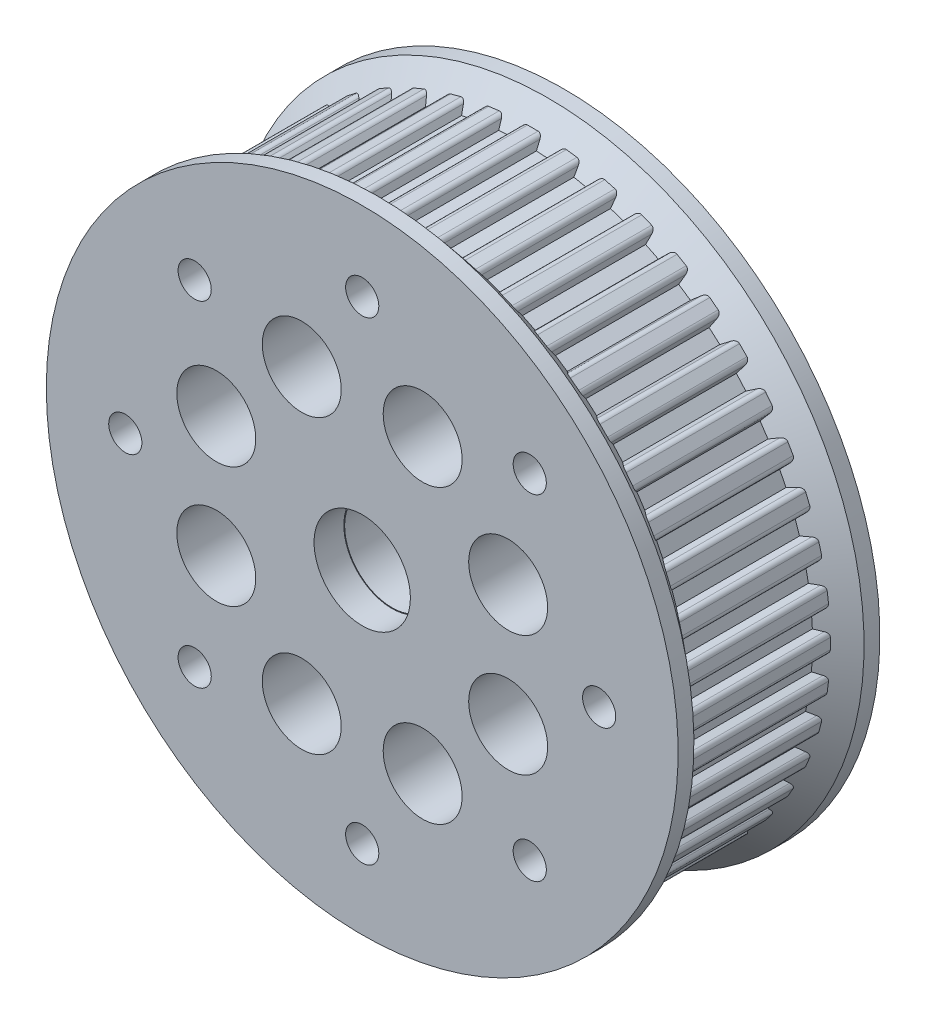
from build123d import *

# Parameters (mm, degrees)
ESQUISSE1_R                  = 6
BOSS_EXTRU_1_DEPTH           = 18
ESQUISSE3_R                  = 2.1
ENL_V_MAT_EXTRU_1_DEPTH      = 63.918405739
ENL_V_MAT_EXTRU_2_DEPTH      = 12
ENL_V_MAT_EXTRU_2_DEPTH_BACK = 12
ESQUISSE4_W                  = 30
ESQUISSE4_H                  = 3
ESQUISSE5_R                  = 8.6
ESQUISSE5_R_2                = 6.1
ENL_V_MAT_EXTRU_3_DEPTH      = 2
ESQUISSE6_R                  = 5
ENL_V_MAT_EXTRU_4_DEPTH      = 63.068880063


with BuildPart() as part:
    # Esquisse1 → Boss.-Extru.1 (new body)
    with BuildSketch(Plane.XY):
        with BuildLine():
            Line((1.485544014, 36.425831274), (3.281690076, 36.308105641))
            Line((3.281690076, 36.308105641), (3.625856871, 37.090284182))
            ThreePointArc((3.625856871, 37.090284182), (3.880729617, 37.371492923), (4.253359473, 37.443503085))
            Line((4.253359473, 37.443503085), (4.918010712, 37.356000089))
            Line((4.918010712, 37.356000089), (5.58266195, 37.268497094))
            ThreePointArc((5.58266195, 37.268497094), (5.92395715, 37.102496915), (6.097363141, 36.764904209))
            Line((6.097363141, 36.764904209), (6.227360034, 35.920300834))
            Line((6.227360034, 35.920300834), (7.992773538, 35.569138254))
            Line((7.992773538, 35.569138254), (8.436090725, 36.299702368))
            ThreePointArc((8.436090725, 36.299702368), (8.725488106, 36.545237761), (9.104329275, 36.567993909))
            Line((9.104329275, 36.567993909), (9.751872896, 36.394485118))
            Line((9.751872896, 36.394485118), (10.399416518, 36.220976328))
            ThreePointArc((10.399416518, 36.220976328), (10.71612452, 36.011848341), (10.843982307, 35.654509763))
            Line((10.843982307, 35.654509763), (10.862624196, 34.800164088))
            Line((10.862624196, 34.800164088), (12.56709843, 34.221573051))
            Line((12.56709843, 34.221573051), (13.101980728, 34.888022583))
            ThreePointArc((13.101980728, 34.888022583), (13.420951075, 35.093683448), (13.799521478, 35.066796219))
            Line((13.799521478, 35.066796219), (14.418877832, 34.810250417))
            Line((14.418877832, 34.810250417), (15.038234187, 34.553704615))
            ThreePointArc((15.038234187, 34.553704615), (15.324936028, 34.305027057), (15.40505793, 33.93405677))
            Line((15.40505793, 33.93405677), (15.312025848, 33.084586886))
            Line((15.312025848, 33.084586886), (16.926396782, 32.288467244))
            Line((16.926396782, 32.288467244), (17.543692209, 32.879399058))
            ThreePointArc((17.543692209, 32.879399058), (17.886777849, 33.041666481), (18.258600042, 32.965595923))
            Line((18.258600042, 32.965595923), (18.839171771, 32.630402679))
            Line((18.839171771, 32.630402679), (19.419743499, 32.295209436))
            ThreePointArc((19.419743499, 32.295209436), (19.671533631, 32.01123725), (19.702548741, 31.632982658))
            Line((19.702548741, 31.632982658), (19.499434491, 30.80292323))
            Line((19.499434491, 30.80292323), (20.996079793, 29.802896811))
            Line((20.996079793, 29.802896811), (21.685226251, 30.3081999))
            ThreePointArc((21.685226251, 30.3081999), (22.046556895, 30.42429744), (22.405268898, 30.300345141))
            Line((22.405268898, 30.300345141), (22.937122257, 29.892239705))
            Line((22.937122257, 29.892239705), (23.468975616, 29.484134269))
            ThreePointArc((23.468975616, 29.484134269), (23.681545841, 29.169726297), (23.66292348, 28.790659442))
            Line((23.66292348, 28.790659442), (23.353202405, 27.994213017))
            Line((23.353202405, 27.994213017), (24.706514058, 26.80739055))
            Line((24.706514058, 26.80739055), (25.455720061, 27.218419038))
            ThreePointArc((25.455720061, 27.218419038), (25.829113241, 27.286360235), (26.168577391, 27.116647053))
            Line((26.168577391, 27.116647053), (26.642612222, 26.642612222))
            Line((26.642612222, 26.642612222), (27.116647053, 26.168577391))
            ThreePointArc((27.116647053, 26.168577391), (27.286360235, 25.829113241), (27.218419038, 25.455720061))
            Line((27.218419038, 25.455720061), (26.80739055, 24.706514058))
            Line((26.80739055, 24.706514058), (27.994213017, 23.353202405))
            Line((27.994213017, 23.353202405), (28.790659442, 23.66292348))
            ThreePointArc((28.790659442, 23.66292348), (29.169726297, 23.681545841), (29.484134269, 23.468975616))
            Line((29.484134269, 23.468975616), (29.892239705, 22.937122257))
            Line((29.892239705, 22.937122257), (30.300345141, 22.405268898))
            ThreePointArc((30.300345141, 22.405268898), (30.42429744, 22.046556895), (30.3081999, 21.685226251))
            Line((30.3081999, 21.685226251), (29.802896811, 20.996079793))
            Line((29.802896811, 20.996079793), (30.80292323, 19.499434491))
            Line((30.80292323, 19.499434491), (31.632982658, 19.702548741))
            ThreePointArc((31.632982658, 19.702548741), (32.01123725, 19.671533631), (32.295209436, 19.419743499))
            Line((32.295209436, 19.419743499), (32.630402679, 18.839171771))
            Line((32.630402679, 18.839171771), (32.965595923, 18.258600042))
            ThreePointArc((32.965595923, 18.258600042), (33.041666481, 17.886777849), (32.879399058, 17.543692209))
            Line((32.879399058, 17.543692209), (32.288467244, 16.926396782))
            Line((32.288467244, 16.926396782), (33.084586886, 15.312025848))
            Line((33.084586886, 15.312025848), (33.93405677, 15.40505793))
            ThreePointArc((33.93405677, 15.40505793), (34.305027057, 15.324936028), (34.553704615, 15.038234187))
            Line((34.553704615, 15.038234187), (34.810250417, 14.418877832))
            Line((34.810250417, 14.418877832), (35.066796219, 13.799521478))
            ThreePointArc((35.066796219, 13.799521478), (35.093683448, 13.420951075), (34.888022583, 13.101980728))
            Line((34.888022583, 13.101980728), (34.221573051, 12.56709843))
            Line((34.221573051, 12.56709843), (34.800164088, 10.862624196))
            Line((34.800164088, 10.862624196), (35.654509763, 10.843982307))
            ThreePointArc((35.654509763, 10.843982307), (36.011848341, 10.71612452), (36.220976328, 10.399416518))
            Line((36.220976328, 10.399416518), (36.394485118, 9.751872896))
            Line((36.394485118, 9.751872896), (36.567993909, 9.104329275))
            ThreePointArc((36.567993909, 9.104329275), (36.545237761, 8.725488106), (36.299702368, 8.436090725))
            Line((36.299702368, 8.436090725), (35.569138254, 7.992773538))
            Line((35.569138254, 7.992773538), (35.920300834, 6.227360034))
            Line((35.920300834, 6.227360034), (36.764904209, 6.097363141))
            ThreePointArc((36.764904209, 6.097363141), (37.102496915, 5.92395715), (37.268497094, 5.58266195))
            Line((37.268497094, 5.58266195), (37.356000089, 4.918010712))
            Line((37.356000089, 4.918010712), (37.443503085, 4.253359473))
            ThreePointArc((37.443503085, 4.253359473), (37.371492923, 3.880729617), (37.090284182, 3.625856871))
            Line((37.090284182, 3.625856871), (36.308105641, 3.281690076))
            Line((36.308105641, 3.281690076), (36.425831274, 1.485544014))
            Line((36.425831274, 1.485544014), (37.24624095, 1.2464164))
            ThreePointArc((37.24624095, 1.2464164), (37.55831148, 1.030429231), (37.678343541, 0.670386487))
            Line((37.678343541, 0.670386487), (37.678343541, 0))
            Line((37.678343541, 0), (37.678343541, -0.670386487))
            ThreePointArc((37.678343541, -0.670386487), (37.55831148, -1.030429231), (37.24624095, -1.2464164))
            Line((37.24624095, -1.2464164), (36.425831274, -1.485544014))
            Line((36.425831274, -1.485544014), (36.308105641, -3.281690076))
            Line((36.308105641, -3.281690076), (37.090284182, -3.625856871))
            ThreePointArc((37.090284182, -3.625856871), (37.371492923, -3.880729617), (37.443503085, -4.253359473))
            Line((37.443503085, -4.253359473), (37.356000089, -4.918010712))
            Line((37.356000089, -4.918010712), (37.268497094, -5.58266195))
            ThreePointArc((37.268497094, -5.58266195), (37.102496915, -5.92395715), (36.764904209, -6.097363141))
            Line((36.764904209, -6.097363141), (35.920300834, -6.227360034))
            Line((35.920300834, -6.227360034), (35.569138254, -7.992773538))
            Line((35.569138254, -7.992773538), (36.299702368, -8.436090725))
            ThreePointArc((36.299702368, -8.436090725), (36.545237761, -8.725488106), (36.567993909, -9.104329275))
            Line((36.567993909, -9.104329275), (36.394485118, -9.751872896))
            Line((36.394485118, -9.751872896), (36.220976328, -10.399416518))
            ThreePointArc((36.220976328, -10.399416518), (36.011848341, -10.71612452), (35.654509763, -10.843982307))
            Line((35.654509763, -10.843982307), (34.800164088, -10.862624196))
            Line((34.800164088, -10.862624196), (34.221573051, -12.56709843))
            Line((34.221573051, -12.56709843), (34.888022583, -13.101980728))
            ThreePointArc((34.888022583, -13.101980728), (35.093683448, -13.420951075), (35.066796219, -13.799521478))
            Line((35.066796219, -13.799521478), (34.810250417, -14.418877832))
            Line((34.810250417, -14.418877832), (34.553704615, -15.038234187))
            ThreePointArc((34.553704615, -15.038234187), (34.305027057, -15.324936028), (33.93405677, -15.40505793))
            Line((33.93405677, -15.40505793), (33.084586886, -15.312025848))
            Line((33.084586886, -15.312025848), (32.288467244, -16.926396782))
            Line((32.288467244, -16.926396782), (32.879399058, -17.543692209))
            ThreePointArc((32.879399058, -17.543692209), (33.041666481, -17.886777849), (32.965595923, -18.258600042))
            Line((32.965595923, -18.258600042), (32.630402679, -18.839171771))
            Line((32.630402679, -18.839171771), (32.295209436, -19.419743499))
            ThreePointArc((32.295209436, -19.419743499), (32.01123725, -19.671533631), (31.632982658, -19.702548741))
            Line((31.632982658, -19.702548741), (30.80292323, -19.499434491))
            Line((30.80292323, -19.499434491), (29.802896811, -20.996079793))
            Line((29.802896811, -20.996079793), (30.3081999, -21.685226251))
            ThreePointArc((30.3081999, -21.685226251), (30.42429744, -22.046556895), (30.300345141, -22.405268898))
            Line((30.300345141, -22.405268898), (29.892239705, -22.937122257))
            Line((29.892239705, -22.937122257), (29.484134269, -23.468975616))
            ThreePointArc((29.484134269, -23.468975616), (29.169726297, -23.681545841), (28.790659442, -23.66292348))
            Line((28.790659442, -23.66292348), (27.994213017, -23.353202405))
            Line((27.994213017, -23.353202405), (26.80739055, -24.706514058))
            Line((26.80739055, -24.706514058), (27.218419038, -25.455720061))
            ThreePointArc((27.218419038, -25.455720061), (27.286360235, -25.829113241), (27.116647053, -26.168577391))
            Line((27.116647053, -26.168577391), (26.642612222, -26.642612222))
            Line((26.642612222, -26.642612222), (26.168577391, -27.116647053))
            ThreePointArc((26.168577391, -27.116647053), (25.829113241, -27.286360235), (25.455720061, -27.218419038))
            Line((25.455720061, -27.218419038), (24.706514058, -26.80739055))
            Line((24.706514058, -26.80739055), (23.353202405, -27.994213017))
            Line((23.353202405, -27.994213017), (23.66292348, -28.790659442))
            ThreePointArc((23.66292348, -28.790659442), (23.681545841, -29.169726297), (23.468975616, -29.484134269))
            Line((23.468975616, -29.484134269), (22.937122257, -29.892239705))
            Line((22.937122257, -29.892239705), (22.405268898, -30.300345141))
            ThreePointArc((22.405268898, -30.300345141), (22.046556895, -30.42429744), (21.685226251, -30.3081999))
            Line((21.685226251, -30.3081999), (20.996079793, -29.802896811))
            Line((20.996079793, -29.802896811), (19.499434491, -30.80292323))
            Line((19.499434491, -30.80292323), (19.702548741, -31.632982658))
            ThreePointArc((19.702548741, -31.632982658), (19.671533631, -32.01123725), (19.419743499, -32.295209436))
            Line((19.419743499, -32.295209436), (18.839171771, -32.630402679))
            Line((18.839171771, -32.630402679), (18.258600042, -32.965595923))
            ThreePointArc((18.258600042, -32.965595923), (17.886777849, -33.041666481), (17.543692209, -32.879399058))
            Line((17.543692209, -32.879399058), (16.926396782, -32.288467244))
            Line((16.926396782, -32.288467244), (15.312025848, -33.084586886))
            Line((15.312025848, -33.084586886), (15.40505793, -33.93405677))
            ThreePointArc((15.40505793, -33.93405677), (15.324936028, -34.305027057), (15.038234187, -34.553704615))
            Line((15.038234187, -34.553704615), (14.418877832, -34.810250417))
            Line((14.418877832, -34.810250417), (13.799521478, -35.066796219))
            ThreePointArc((13.799521478, -35.066796219), (13.420951075, -35.093683448), (13.101980728, -34.888022583))
            Line((13.101980728, -34.888022583), (12.56709843, -34.221573051))
            Line((12.56709843, -34.221573051), (10.862624196, -34.800164088))
            Line((10.862624196, -34.800164088), (10.843982307, -35.654509763))
            ThreePointArc((10.843982307, -35.654509763), (10.71612452, -36.011848341), (10.399416518, -36.220976328))
            Line((10.399416518, -36.220976328), (9.751872896, -36.394485118))
            Line((9.751872896, -36.394485118), (9.104329275, -36.567993909))
            ThreePointArc((9.104329275, -36.567993909), (8.725488106, -36.545237761), (8.436090725, -36.299702368))
            Line((8.436090725, -36.299702368), (7.992773538, -35.569138254))
            Line((7.992773538, -35.569138254), (6.227360034, -35.920300834))
            Line((6.227360034, -35.920300834), (6.097363141, -36.764904209))
            ThreePointArc((6.097363141, -36.764904209), (5.92395715, -37.102496915), (5.58266195, -37.268497094))
            Line((5.58266195, -37.268497094), (4.918010712, -37.356000089))
            Line((4.918010712, -37.356000089), (4.253359473, -37.443503085))
            ThreePointArc((4.253359473, -37.443503085), (3.880729617, -37.371492923), (3.625856871, -37.090284182))
            Line((3.625856871, -37.090284182), (3.281690076, -36.308105641))
            Line((3.281690076, -36.308105641), (1.485544014, -36.425831274))
            Line((1.485544014, -36.425831274), (1.2464164, -37.24624095))
            ThreePointArc((1.2464164, -37.24624095), (1.030429231, -37.55831148), (0.670386487, -37.678343541))
            Line((0.670386487, -37.678343541), (0, -37.678343541))
            Line((0, -37.678343541), (-0.670386487, -37.678343541))
            ThreePointArc((-0.670386487, -37.678343541), (-1.030429231, -37.55831148), (-1.2464164, -37.24624095))
            Line((-1.2464164, -37.24624095), (-1.485544014, -36.425831274))
            Line((-1.485544014, -36.425831274), (-3.281690076, -36.308105641))
            Line((-3.281690076, -36.308105641), (-3.625856871, -37.090284182))
            ThreePointArc((-3.625856871, -37.090284182), (-3.880729617, -37.371492923), (-4.253359473, -37.443503085))
            Line((-4.253359473, -37.443503085), (-4.918010712, -37.356000089))
            Line((-4.918010712, -37.356000089), (-5.58266195, -37.268497094))
            ThreePointArc((-5.58266195, -37.268497094), (-5.92395715, -37.102496915), (-6.097363141, -36.764904209))
            Line((-6.097363141, -36.764904209), (-6.227360034, -35.920300834))
            Line((-6.227360034, -35.920300834), (-7.992773538, -35.569138254))
            Line((-7.992773538, -35.569138254), (-8.436090725, -36.299702368))
            ThreePointArc((-8.436090725, -36.299702368), (-8.725488106, -36.545237761), (-9.104329275, -36.567993909))
            Line((-9.104329275, -36.567993909), (-9.751872896, -36.394485118))
            Line((-9.751872896, -36.394485118), (-10.399416518, -36.220976328))
            ThreePointArc((-10.399416518, -36.220976328), (-10.71612452, -36.011848341), (-10.843982307, -35.654509763))
            Line((-10.843982307, -35.654509763), (-10.862624196, -34.800164088))
            Line((-10.862624196, -34.800164088), (-12.56709843, -34.221573051))
            Line((-12.56709843, -34.221573051), (-13.101980728, -34.888022583))
            ThreePointArc((-13.101980728, -34.888022583), (-13.420951075, -35.093683448), (-13.799521478, -35.066796219))
            Line((-13.799521478, -35.066796219), (-14.418877832, -34.810250417))
            Line((-14.418877832, -34.810250417), (-15.038234187, -34.553704615))
            ThreePointArc((-15.038234187, -34.553704615), (-15.324936028, -34.305027057), (-15.40505793, -33.93405677))
            Line((-15.40505793, -33.93405677), (-15.312025848, -33.084586886))
            Line((-15.312025848, -33.084586886), (-16.926396782, -32.288467244))
            Line((-16.926396782, -32.288467244), (-17.543692209, -32.879399058))
            ThreePointArc((-17.543692209, -32.879399058), (-17.886777849, -33.041666481), (-18.258600042, -32.965595923))
            Line((-18.258600042, -32.965595923), (-18.839171771, -32.630402679))
            Line((-18.839171771, -32.630402679), (-19.419743499, -32.295209436))
            ThreePointArc((-19.419743499, -32.295209436), (-19.671533631, -32.01123725), (-19.702548741, -31.632982658))
            Line((-19.702548741, -31.632982658), (-19.499434491, -30.80292323))
            Line((-19.499434491, -30.80292323), (-20.996079793, -29.802896811))
            Line((-20.996079793, -29.802896811), (-21.685226251, -30.3081999))
            ThreePointArc((-21.685226251, -30.3081999), (-22.046556895, -30.42429744), (-22.405268898, -30.300345141))
            Line((-22.405268898, -30.300345141), (-22.937122257, -29.892239705))
            Line((-22.937122257, -29.892239705), (-23.468975616, -29.484134269))
            ThreePointArc((-23.468975616, -29.484134269), (-23.681545841, -29.169726297), (-23.66292348, -28.790659442))
            Line((-23.66292348, -28.790659442), (-23.353202405, -27.994213017))
            Line((-23.353202405, -27.994213017), (-24.706514058, -26.80739055))
            Line((-24.706514058, -26.80739055), (-25.455720061, -27.218419038))
            ThreePointArc((-25.455720061, -27.218419038), (-25.829113241, -27.286360235), (-26.168577391, -27.116647053))
            Line((-26.168577391, -27.116647053), (-26.642612222, -26.642612222))
            Line((-26.642612222, -26.642612222), (-27.116647053, -26.168577391))
            ThreePointArc((-27.116647053, -26.168577391), (-27.286360235, -25.829113241), (-27.218419038, -25.455720061))
            Line((-27.218419038, -25.455720061), (-26.80739055, -24.706514058))
            Line((-26.80739055, -24.706514058), (-27.994213017, -23.353202405))
            Line((-27.994213017, -23.353202405), (-28.790659442, -23.66292348))
            ThreePointArc((-28.790659442, -23.66292348), (-29.169726297, -23.681545841), (-29.484134269, -23.468975616))
            Line((-29.484134269, -23.468975616), (-29.892239705, -22.937122257))
            Line((-29.892239705, -22.937122257), (-30.300345141, -22.405268898))
            ThreePointArc((-30.300345141, -22.405268898), (-30.42429744, -22.046556895), (-30.3081999, -21.685226251))
            Line((-30.3081999, -21.685226251), (-29.802896811, -20.996079793))
            Line((-29.802896811, -20.996079793), (-30.80292323, -19.499434491))
            Line((-30.80292323, -19.499434491), (-31.632982658, -19.702548741))
            ThreePointArc((-31.632982658, -19.702548741), (-32.01123725, -19.671533631), (-32.295209436, -19.419743499))
            Line((-32.295209436, -19.419743499), (-32.630402679, -18.839171771))
            Line((-32.630402679, -18.839171771), (-32.965595923, -18.258600042))
            ThreePointArc((-32.965595923, -18.258600042), (-33.041666481, -17.886777849), (-32.879399058, -17.543692209))
            Line((-32.879399058, -17.543692209), (-32.288467244, -16.926396782))
            Line((-32.288467244, -16.926396782), (-33.084586886, -15.312025848))
            Line((-33.084586886, -15.312025848), (-33.93405677, -15.40505793))
            ThreePointArc((-33.93405677, -15.40505793), (-34.305027057, -15.324936028), (-34.553704615, -15.038234187))
            Line((-34.553704615, -15.038234187), (-34.810250417, -14.418877832))
            Line((-34.810250417, -14.418877832), (-35.066796219, -13.799521478))
            ThreePointArc((-35.066796219, -13.799521478), (-35.093683448, -13.420951075), (-34.888022583, -13.101980728))
            Line((-34.888022583, -13.101980728), (-34.221573051, -12.56709843))
            Line((-34.221573051, -12.56709843), (-34.800164088, -10.862624196))
            Line((-34.800164088, -10.862624196), (-35.654509763, -10.843982307))
            ThreePointArc((-35.654509763, -10.843982307), (-36.011848341, -10.71612452), (-36.220976328, -10.399416518))
            Line((-36.220976328, -10.399416518), (-36.394485118, -9.751872896))
            Line((-36.394485118, -9.751872896), (-36.567993909, -9.104329275))
            ThreePointArc((-36.567993909, -9.104329275), (-36.545237761, -8.725488106), (-36.299702368, -8.436090725))
            Line((-36.299702368, -8.436090725), (-35.569138254, -7.992773538))
            Line((-35.569138254, -7.992773538), (-35.920300834, -6.227360034))
            Line((-35.920300834, -6.227360034), (-36.764904209, -6.097363141))
            ThreePointArc((-36.764904209, -6.097363141), (-37.102496915, -5.92395715), (-37.268497094, -5.58266195))
            Line((-37.268497094, -5.58266195), (-37.356000089, -4.918010712))
            Line((-37.356000089, -4.918010712), (-37.443503085, -4.253359473))
            ThreePointArc((-37.443503085, -4.253359473), (-37.371492923, -3.880729617), (-37.090284182, -3.625856871))
            Line((-37.090284182, -3.625856871), (-36.308105641, -3.281690076))
            Line((-36.308105641, -3.281690076), (-36.425831274, -1.485544014))
            Line((-36.425831274, -1.485544014), (-37.24624095, -1.2464164))
            ThreePointArc((-37.24624095, -1.2464164), (-37.55831148, -1.030429231), (-37.678343541, -0.670386487))
            Line((-37.678343541, -0.670386487), (-37.678343541, 0))
            Line((-37.678343541, 0), (-37.678343541, 0.670386487))
            ThreePointArc((-37.678343541, 0.670386487), (-37.55831148, 1.030429231), (-37.24624095, 1.2464164))
            Line((-37.24624095, 1.2464164), (-36.425831274, 1.485544014))
            Line((-36.425831274, 1.485544014), (-36.308105641, 3.281690076))
            Line((-36.308105641, 3.281690076), (-37.090284182, 3.625856871))
            ThreePointArc((-37.090284182, 3.625856871), (-37.371492923, 3.880729617), (-37.443503085, 4.253359473))
            Line((-37.443503085, 4.253359473), (-37.356000089, 4.918010712))
            Line((-37.356000089, 4.918010712), (-37.268497094, 5.58266195))
            ThreePointArc((-37.268497094, 5.58266195), (-37.102496915, 5.92395715), (-36.764904209, 6.097363141))
            Line((-36.764904209, 6.097363141), (-35.920300834, 6.227360034))
            Line((-35.920300834, 6.227360034), (-35.569138254, 7.992773538))
            Line((-35.569138254, 7.992773538), (-36.299702368, 8.436090725))
            ThreePointArc((-36.299702368, 8.436090725), (-36.545237761, 8.725488106), (-36.567993909, 9.104329275))
            Line((-36.567993909, 9.104329275), (-36.394485118, 9.751872896))
            Line((-36.394485118, 9.751872896), (-36.220976328, 10.399416518))
            ThreePointArc((-36.220976328, 10.399416518), (-36.011848341, 10.71612452), (-35.654509763, 10.843982307))
            Line((-35.654509763, 10.843982307), (-34.800164088, 10.862624196))
            Line((-34.800164088, 10.862624196), (-34.221573051, 12.56709843))
            Line((-34.221573051, 12.56709843), (-34.888022583, 13.101980728))
            ThreePointArc((-34.888022583, 13.101980728), (-35.093683448, 13.420951075), (-35.066796219, 13.799521478))
            Line((-35.066796219, 13.799521478), (-34.810250417, 14.418877832))
            Line((-34.810250417, 14.418877832), (-34.553704615, 15.038234187))
            ThreePointArc((-34.553704615, 15.038234187), (-34.305027057, 15.324936028), (-33.93405677, 15.40505793))
            Line((-33.93405677, 15.40505793), (-33.084586886, 15.312025848))
            Line((-33.084586886, 15.312025848), (-32.288467244, 16.926396782))
            Line((-32.288467244, 16.926396782), (-32.879399058, 17.543692209))
            ThreePointArc((-32.879399058, 17.543692209), (-33.041666481, 17.886777849), (-32.965595923, 18.258600042))
            Line((-32.965595923, 18.258600042), (-32.630402679, 18.839171771))
            Line((-32.630402679, 18.839171771), (-32.295209436, 19.419743499))
            ThreePointArc((-32.295209436, 19.419743499), (-32.01123725, 19.671533631), (-31.632982658, 19.702548741))
            Line((-31.632982658, 19.702548741), (-30.80292323, 19.499434491))
            Line((-30.80292323, 19.499434491), (-29.802896811, 20.996079793))
            Line((-29.802896811, 20.996079793), (-30.3081999, 21.685226251))
            ThreePointArc((-30.3081999, 21.685226251), (-30.42429744, 22.046556895), (-30.300345141, 22.405268898))
            Line((-30.300345141, 22.405268898), (-29.892239705, 22.937122257))
            Line((-29.892239705, 22.937122257), (-29.484134269, 23.468975616))
            ThreePointArc((-29.484134269, 23.468975616), (-29.169726297, 23.681545841), (-28.790659442, 23.66292348))
            Line((-28.790659442, 23.66292348), (-27.994213017, 23.353202405))
            Line((-27.994213017, 23.353202405), (-26.80739055, 24.706514058))
            Line((-26.80739055, 24.706514058), (-27.218419038, 25.455720061))
            ThreePointArc((-27.218419038, 25.455720061), (-27.286360235, 25.829113241), (-27.116647053, 26.168577391))
            Line((-27.116647053, 26.168577391), (-26.642612222, 26.642612222))
            Line((-26.642612222, 26.642612222), (-26.168577391, 27.116647053))
            ThreePointArc((-26.168577391, 27.116647053), (-25.829113241, 27.286360235), (-25.455720061, 27.218419038))
            Line((-25.455720061, 27.218419038), (-24.706514058, 26.80739055))
            Line((-24.706514058, 26.80739055), (-23.353202405, 27.994213017))
            Line((-23.353202405, 27.994213017), (-23.66292348, 28.790659442))
            ThreePointArc((-23.66292348, 28.790659442), (-23.681545841, 29.169726297), (-23.468975616, 29.484134269))
            Line((-23.468975616, 29.484134269), (-22.937122257, 29.892239705))
            Line((-22.937122257, 29.892239705), (-22.405268898, 30.300345141))
            ThreePointArc((-22.405268898, 30.300345141), (-22.046556895, 30.42429744), (-21.685226251, 30.3081999))
            Line((-21.685226251, 30.3081999), (-20.996079793, 29.802896811))
            Line((-20.996079793, 29.802896811), (-19.499434491, 30.80292323))
            Line((-19.499434491, 30.80292323), (-19.702548741, 31.632982658))
            ThreePointArc((-19.702548741, 31.632982658), (-19.671533631, 32.01123725), (-19.419743499, 32.295209436))
            Line((-19.419743499, 32.295209436), (-18.839171771, 32.630402679))
            Line((-18.839171771, 32.630402679), (-18.258600042, 32.965595923))
            ThreePointArc((-18.258600042, 32.965595923), (-17.886777849, 33.041666481), (-17.543692209, 32.879399058))
            Line((-17.543692209, 32.879399058), (-16.926396782, 32.288467244))
            Line((-16.926396782, 32.288467244), (-15.312025848, 33.084586886))
            Line((-15.312025848, 33.084586886), (-15.40505793, 33.93405677))
            ThreePointArc((-15.40505793, 33.93405677), (-15.324936028, 34.305027057), (-15.038234187, 34.553704615))
            Line((-15.038234187, 34.553704615), (-14.418877832, 34.810250417))
            Line((-14.418877832, 34.810250417), (-13.799521478, 35.066796219))
            ThreePointArc((-13.799521478, 35.066796219), (-13.420951075, 35.093683448), (-13.101980728, 34.888022583))
            Line((-13.101980728, 34.888022583), (-12.56709843, 34.221573051))
            Line((-12.56709843, 34.221573051), (-10.862624196, 34.800164088))
            Line((-10.862624196, 34.800164088), (-10.843982307, 35.654509763))
            ThreePointArc((-10.843982307, 35.654509763), (-10.71612452, 36.011848341), (-10.399416518, 36.220976328))
            Line((-10.399416518, 36.220976328), (-9.751872896, 36.394485118))
            Line((-9.751872896, 36.394485118), (-9.104329275, 36.567993909))
            ThreePointArc((-9.104329275, 36.567993909), (-8.725488106, 36.545237761), (-8.436090725, 36.299702368))
            Line((-8.436090725, 36.299702368), (-7.992773538, 35.569138254))
            Line((-7.992773538, 35.569138254), (-6.227360034, 35.920300834))
            Line((-6.227360034, 35.920300834), (-6.097363141, 36.764904209))
            ThreePointArc((-6.097363141, 36.764904209), (-5.92395715, 37.102496915), (-5.58266195, 37.268497094))
            Line((-5.58266195, 37.268497094), (-4.918010712, 37.356000089))
            Line((-4.918010712, 37.356000089), (-4.253359473, 37.443503085))
            ThreePointArc((-4.253359473, 37.443503085), (-3.880729617, 37.371492923), (-3.625856871, 37.090284182))
            Line((-3.625856871, 37.090284182), (-3.281690076, 36.308105641))
            Line((-3.281690076, 36.308105641), (-1.485544014, 36.425831274))
            Line((-1.485544014, 36.425831274), (-1.2464164, 37.24624095))
            ThreePointArc((-1.2464164, 37.24624095), (-1.030429231, 37.55831148), (-0.670386487, 37.678343541))
            Line((-0.670386487, 37.678343541), (0, 37.678343541))
            Line((0, 37.678343541), (0.670386487, 37.678343541))
            ThreePointArc((0.670386487, 37.678343541), (1.030429231, 37.55831148), (1.2464164, 37.24624095))
            Line((1.2464164, 37.24624095), (1.485544014, 36.425831274))
        make_face()
        Circle(ESQUISSE1_R, mode=Mode.SUBTRACT)
    extrude(amount=BOSS_EXTRU_1_DEPTH)

    # Esquisse2 → Révolution1 (revolve)
    with BuildSketch(Plane(origin=(0, 0, 0), x_dir=(1, 0, 0), z_dir=(0, 1, 0))):
        Polygon((-6.1, -23.772488562), (-6.1, 5.772488562), (-8.6, 5.772488562), (-8.6, 3.772488562), (-40, 3.772488562), (-40, 1.772488562), (-36.1, -1.5), (-36.1, -16.5), (-40, -19.772488562), (-40, -21.772488562), (-8.6, -21.772488562), (-8.6, -23.772488562), align=None)
    revolve(axis=Axis((0, 0, 0), (0, 0, 1)))

    # Esquisse3 → Enlèv. mat.-Extru.1 (cut, through all)
    with BuildSketch(Plane(origin=(0, 0, -3.772488562), x_dir=(-1, 0, 0), z_dir=(0, 0, -1))):
        with Locations((0, 30)):
            Circle(ESQUISSE3_R)
        with Locations((21.213203436, 21.213203436)):
            Circle(ESQUISSE3_R)
        with Locations((30, 0)):
            Circle(ESQUISSE3_R)
        with Locations((21.213203436, -21.213203436)):
            Circle(ESQUISSE3_R)
        with Locations((0, -30)):
            Circle(ESQUISSE3_R)
        with Locations((-21.213203436, -21.213203436)):
            Circle(ESQUISSE3_R)
        with Locations((-30, 0)):
            Circle(ESQUISSE3_R)
        with Locations((-21.213203436, 21.213203436)):
            Circle(ESQUISSE3_R)
    extrude(amount=-ENL_V_MAT_EXTRU_1_DEPTH, mode=Mode.SUBTRACT)

    # Esquisse4 → Enlèv. mat.-Extru.2 (cut, two sides: drawn at the far end of the back side and taken through both)
    with BuildSketch(Plane(origin=(0, 0, -3.772488562), x_dir=(-1, 0, 0), z_dir=(0, 0, -1)).offset(-ENL_V_MAT_EXTRU_2_DEPTH_BACK)):
        Rectangle(ESQUISSE4_W, ESQUISSE4_H)
    extrude(amount=ENL_V_MAT_EXTRU_2_DEPTH + ENL_V_MAT_EXTRU_2_DEPTH_BACK, mode=Mode.SUBTRACT)

    # Esquisse5 → Enlèv. mat.-Extru.3 (cut)
    with BuildSketch(Plane.XY.offset(23.772488562)):
        Circle(ESQUISSE5_R)
        Circle(ESQUISSE5_R_2, mode=Mode.SUBTRACT)
    extrude(amount=-ENL_V_MAT_EXTRU_3_DEPTH, mode=Mode.SUBTRACT)

    # Esquisse6 → Enlèv. mat.-Extru.4 (cut, through all)
    with BuildSketch(Plane(origin=(0, 0, -3.772488562), x_dir=(-1, 0, 0), z_dir=(0, 0, -1))):
        with Locations((7.653668647, -18.47759065)):
            Circle(ESQUISSE6_R)
        with Locations((-7.653668647, -18.47759065)):
            Circle(ESQUISSE6_R)
        with Locations((-18.47759065, -7.653668647)):
            Circle(ESQUISSE6_R)
        with Locations((-18.47759065, 7.653668647)):
            Circle(ESQUISSE6_R)
        with Locations((-7.653668647, 18.47759065)):
            Circle(ESQUISSE6_R)
        with Locations((7.653668647, 18.47759065)):
            Circle(ESQUISSE6_R)
        with Locations((18.47759065, 7.653668647)):
            Circle(ESQUISSE6_R)
        with Locations((18.47759065, -7.653668647)):
            Circle(ESQUISSE6_R)
    extrude(amount=-ENL_V_MAT_EXTRU_4_DEPTH, mode=Mode.SUBTRACT)


solid = part.part
